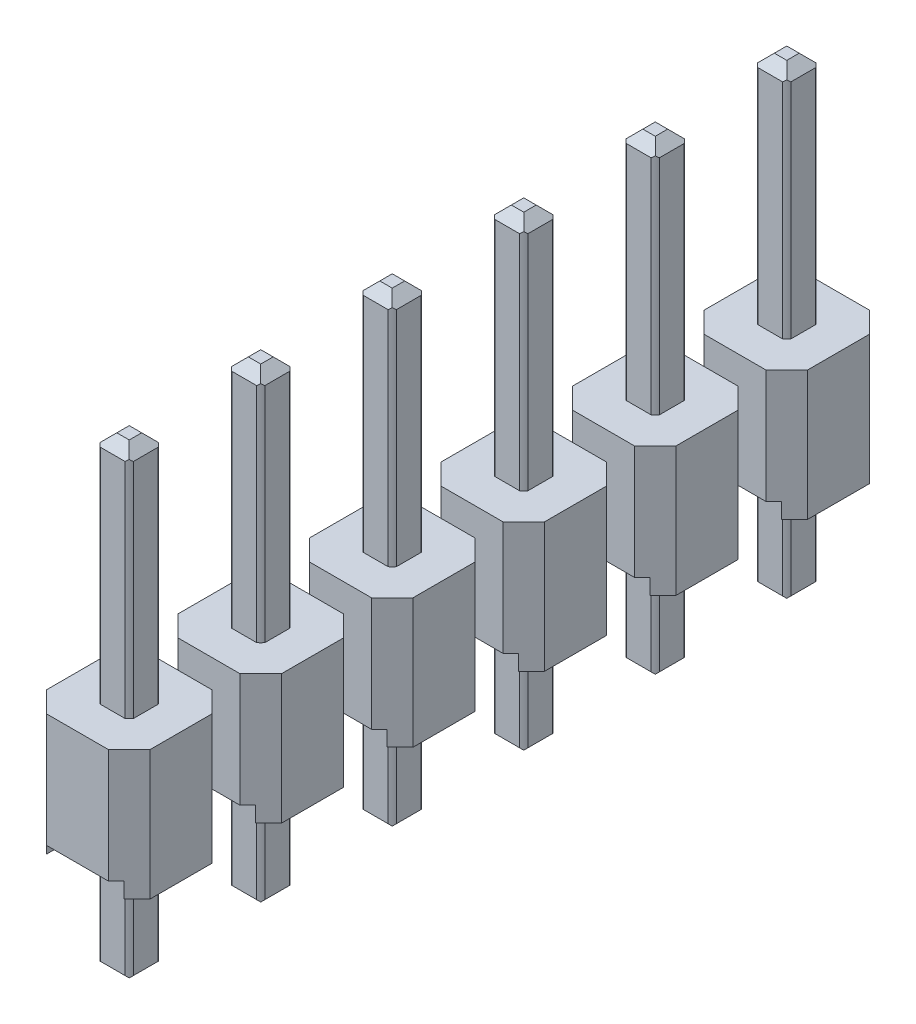
from build123d import *

# Parameters (mm, degrees)
SKETCH3_W                = 2
SKETCH3_H                = 2
BOSS_EXTRUDE3_DEPTH      = 2.5
SKETCH4_W                = 1.5
SKETCH4_H                = 0.3
CUT_EXTRUDE1_DEPTH       = 4.354101966
CHAMFER1_SIZE            = 0.4
BOSS_EXTRUDE4_DEPTH      = 7
BOSS_EXTRUDE4_DEPTH_BACK = 2
CHAMFER2_SIZE            = 0.2
LPATTERN1_COUNT          = 6
LPATTERN1_PITCH          = 2.54


with BuildPart() as part:
    # Sketch3 → Boss-Extrude3 (new body)
    with BuildSketch(Plane(origin=(0, 0, 0), x_dir=(1, 0, 0), z_dir=(0, 1, 0))):
        Rectangle(SKETCH3_W, SKETCH3_H)
    extrude(amount=BOSS_EXTRUDE3_DEPTH)

    # Sketch4 → Cut-Extrude1 (cut, through all)
    with BuildSketch(Plane.XY.offset(1)):
        with Locations((0, 0.15)):
            Rectangle(SKETCH4_W, SKETCH4_H)
    extrude(amount=-CUT_EXTRUDE1_DEPTH, mode=Mode.SUBTRACT)

    # Chamfer1
    chamfer1_edges = [part.edges().sort_by_distance(p)[0] for p in [
        (-1, 1.25, 1),
        (-1, 1.25, -1),
        (1, 1.25, -1),
        (1, 1.25, 1),
    ]]
    chamfer(chamfer1_edges, length=CHAMFER1_SIZE)

    # Sketch5 → Boss-Extrude4 (add, two sides: drawn at the far end of the back side and taken through both)
    with BuildSketch(Plane(origin=(0, 0, 0), x_dir=(1, 0, 0), z_dir=(0, 1, 0)).offset(-BOSS_EXTRUDE4_DEPTH_BACK)):
        with BuildLine():
            Line((-0.24, -0.32), (0.24, -0.32))
            ThreePointArc((0.24, -0.32), (0.282842712, -0.282842712), (0.32, -0.24))
            Line((0.32, -0.24), (0.32, 0.24))
            ThreePointArc((0.32, 0.24), (0.282842712, 0.282842712), (0.24, 0.32))
            Line((0.24, 0.32), (-0.24, 0.32))
            ThreePointArc((-0.24, 0.32), (-0.282842712, 0.282842712), (-0.32, 0.24))
            Line((-0.32, 0.24), (-0.32, -0.24))
            ThreePointArc((-0.32, -0.24), (-0.282842712, -0.282842712), (-0.24, -0.32))
        make_face()
    extrude(amount=BOSS_EXTRUDE4_DEPTH + BOSS_EXTRUDE4_DEPTH_BACK)

    # Chamfer2
    # the kernel refuses this chamfer: 0.2 mm, written as the material it takes off along each edge
    with BuildSketch(Plane(origin=(0.32, -2, 0.754336598), x_dir=(0.027495876610586285, 0.9996219169112968, 0), z_dir=(0, 0, -1)), Plane(origin=(0.754336598, -2, -0.32), x_dir=(0, 0.9996219169112968, -0.027495876610586285), z_dir=(-1, 0, 0)), Plane(origin=(-0.32, -2, -0.754336598), x_dir=(-0.027495876610586285, 0.9996219169112968, 0), z_dir=(0, 0, 1)), Plane(origin=(-0.754336598, -2, 0.32), x_dir=(0, 0.9996219169112968, 0.027495876610586285), z_dir=(1, 0, 0))) as chamfer2_piece_1:
        Polygon((CHAMFER2_SIZE * 0.999621916911, -CHAMFER2_SIZE * 0.0274958766106), (-CHAMFER2_SIZE * 0.0274958766106, -CHAMFER2_SIZE * 0.999621916911), (0, 0), align=None)
    extrude(amount=1.508673195, mode=Mode.SUBTRACT)
    with BuildSketch(Plane(origin=(-0.754336598, 7, 0.32), x_dir=(0, -0.9996219169112968, 0.027495876610586226), z_dir=(1, 0, 0)), Plane(origin=(-0.32, 7, -0.754336598), x_dir=(-0.027495876610586223, -0.9996219169112966, 0), z_dir=(0, 0, 1)), Plane(origin=(0.754336598, 7, -0.32), x_dir=(0, -0.9996219169112968, -0.027495876610586226), z_dir=(-1, 0, 0)), Plane(origin=(0.32, 7, 0.754336598), x_dir=(0.027495876610586223, -0.9996219169112966, 0), z_dir=(0, 0, -1))) as chamfer2_piece_2:
        Polygon((CHAMFER2_SIZE * 0.999621916911, CHAMFER2_SIZE * 0.0274958766106), (-CHAMFER2_SIZE * 0.0274958766106, CHAMFER2_SIZE * 0.999621916911), (0, 0), align=None)
    extrude(amount=1.508673195, mode=Mode.SUBTRACT)


with BuildPart() as lpattern1_1:
    # LPattern1: pattern copy
    add(part.part.moved(Location(Vector(0, 0, -1) * (1 * LPATTERN1_PITCH))))


with BuildPart() as lpattern1_2:
    # LPattern1: pattern copy
    add(part.part.moved(Location(Vector(0, 0, -1) * (2 * LPATTERN1_PITCH))))


with BuildPart() as lpattern1_3:
    # LPattern1: pattern copy
    add(part.part.moved(Location(Vector(0, 0, -1) * (3 * LPATTERN1_PITCH))))


with BuildPart() as lpattern1_4:
    # LPattern1: pattern copy
    add(part.part.moved(Location(Vector(0, 0, -1) * (4 * LPATTERN1_PITCH))))


with BuildPart() as lpattern1_5:
    # LPattern1: pattern copy
    add(part.part.moved(Location(Vector(0, 0, -1) * (5 * LPATTERN1_PITCH))))


solid = Compound([part.part, lpattern1_1.part, lpattern1_2.part, lpattern1_3.part, lpattern1_4.part, lpattern1_5.part])
